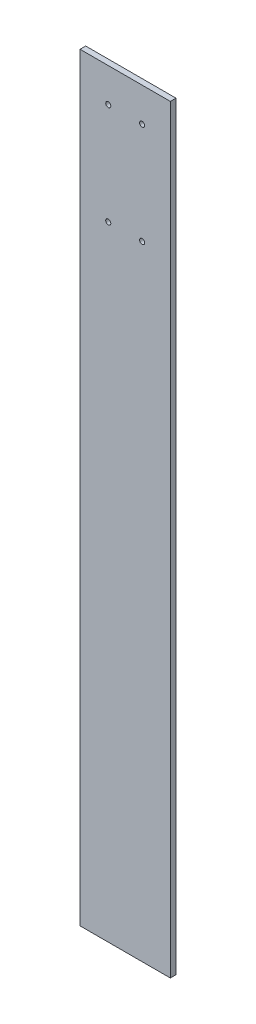
from build123d import *

# Parameters (mm, degrees)
SKETCH1_W           = 50.8
SKETCH1_H           = 3.175
BOSS_EXTRUDE1_DEPTH = 427.1518
SKETCH4_R           = 1.4224
CUT_EXTRUDE2_DEPTH  = 2.54
SKETCH5_W           = 12.58267919
SKETCH5_H           = 101.029760921
BOSS_EXTRUDE2_DEPTH = 2.54
SKETCH6_W           = 7.546607927
SKETCH6_H           = 108.671154153
SKETCH6_W_2         = 9.055929513
BOSS_EXTRUDE3_DEPTH = 2.54
SKETCH7_W           = 50.8
SKETCH7_H           = 16.51
BOSS_EXTRUDE4_DEPTH = 3.175
SKETCH8_W           = 50.8
SKETCH8_H           = 51.188017092
BOSS_EXTRUDE5_DEPTH = 3.175
SKETCH9_W           = 50.8
SKETCH9_H           = 70.169066632
BOSS_EXTRUDE6_DEPTH = 3.175


with BuildPart() as part:
    # Sketch1 → Boss-Extrude1 (new body)
    with BuildSketch(Plane(origin=(0, 0, 0), x_dir=(1, 0, 0), z_dir=(0, 1, 0))):
        with Locations((0, 70.254548969)):
            Rectangle(SKETCH1_W, SKETCH1_H)
    extrude(amount=BOSS_EXTRUDE1_DEPTH)

    # Sketch4 → Cut-Extrude2 (cut)
    with BuildSketch(Plane.XY.offset(-68.667048969)):
        with Locations((-3.175, 376.3518)):
            Circle(SKETCH4_R)
        with Locations((-9.525, 376.3518)):
            Circle(SKETCH4_R)
        with Locations((-9.525, 370.0018)):
            Circle(SKETCH4_R)
        with Locations((-9.525, 363.6518)):
            Circle(SKETCH4_R)
        with Locations((-9.525, 357.3018)):
            Circle(SKETCH4_R)
        with Locations((-9.525, 350.9518)):
            Circle(SKETCH4_R)
        with Locations((-9.525, 344.6018)):
            Circle(SKETCH4_R)
        with Locations((-9.525, 338.2518)):
            Circle(SKETCH4_R)
        with Locations((-9.525, 331.9018)):
            Circle(SKETCH4_R)
        with Locations((-9.525, 325.5518)):
            Circle(SKETCH4_R)
        with Locations((-9.525, 319.2018)):
            Circle(SKETCH4_R)
        with Locations((-9.525, 312.8518)):
            Circle(SKETCH4_R)
        with Locations((-9.525, 306.5018)):
            Circle(SKETCH4_R)
        with Locations((-9.525, 300.1518)):
            Circle(SKETCH4_R)
        with Locations((-9.525, 293.8018)):
            Circle(SKETCH4_R)
        with Locations((-9.525, 287.4518)):
            Circle(SKETCH4_R)
        with Locations((-9.525, 281.1018)):
            Circle(SKETCH4_R)
        with Locations((-3.175, 370.0018)):
            Circle(SKETCH4_R)
        with Locations((-3.175, 363.6518)):
            Circle(SKETCH4_R)
        with Locations((-3.175, 357.3018)):
            Circle(SKETCH4_R)
        with Locations((-3.175, 350.9518)):
            Circle(SKETCH4_R)
        with Locations((-3.175, 344.6018)):
            Circle(SKETCH4_R)
        with Locations((-3.175, 338.2518)):
            Circle(SKETCH4_R)
        with Locations((-3.175, 331.9018)):
            Circle(SKETCH4_R)
        with Locations((-3.175, 325.5518)):
            Circle(SKETCH4_R)
        with Locations((-3.175, 319.2018)):
            Circle(SKETCH4_R)
        with Locations((-3.175, 312.8518)):
            Circle(SKETCH4_R)
        with Locations((-3.175, 306.5018)):
            Circle(SKETCH4_R)
        with Locations((-3.175, 300.1518)):
            Circle(SKETCH4_R)
        with Locations((-3.175, 293.8018)):
            Circle(SKETCH4_R)
        with Locations((-3.175, 287.4518)):
            Circle(SKETCH4_R)
        with Locations((-3.175, 281.1018)):
            Circle(SKETCH4_R)
        with Locations((3.175, 281.1018)):
            Circle(SKETCH4_R)
        with Locations((3.175, 287.4518)):
            Circle(SKETCH4_R)
        with Locations((3.175, 293.8018)):
            Circle(SKETCH4_R)
        with Locations((3.175, 300.1518)):
            Circle(SKETCH4_R)
        with Locations((3.175, 306.5018)):
            Circle(SKETCH4_R)
        with Locations((3.175, 312.8518)):
            Circle(SKETCH4_R)
        with Locations((3.175, 319.2018)):
            Circle(SKETCH4_R)
        with Locations((3.175, 325.5518)):
            Circle(SKETCH4_R)
        with Locations((3.175, 331.9018)):
            Circle(SKETCH4_R)
        with Locations((3.175, 338.2518)):
            Circle(SKETCH4_R)
        with Locations((3.175, 344.6018)):
            Circle(SKETCH4_R)
        with Locations((3.175, 350.9518)):
            Circle(SKETCH4_R)
        with Locations((3.175, 357.3018)):
            Circle(SKETCH4_R)
        with Locations((3.175, 363.6518)):
            Circle(SKETCH4_R)
        with Locations((3.175, 370.0018)):
            Circle(SKETCH4_R)
        with Locations((9.525, 281.1018)):
            Circle(SKETCH4_R)
        with Locations((9.525, 287.4518)):
            Circle(SKETCH4_R)
        with Locations((9.525, 293.8018)):
            Circle(SKETCH4_R)
        with Locations((9.525, 300.1518)):
            Circle(SKETCH4_R)
        with Locations((9.525, 306.5018)):
            Circle(SKETCH4_R)
        with Locations((9.525, 312.8518)):
            Circle(SKETCH4_R)
        with Locations((9.525, 319.2018)):
            Circle(SKETCH4_R)
        with Locations((9.525, 325.5518)):
            Circle(SKETCH4_R)
        with Locations((9.525, 331.9018)):
            Circle(SKETCH4_R)
        with Locations((9.525, 338.2518)):
            Circle(SKETCH4_R)
        with Locations((9.525, 344.6018)):
            Circle(SKETCH4_R)
        with Locations((9.525, 350.9518)):
            Circle(SKETCH4_R)
        with Locations((9.525, 357.3018)):
            Circle(SKETCH4_R)
        with Locations((9.525, 363.6518)):
            Circle(SKETCH4_R)
        with Locations((9.525, 370.0018)):
            Circle(SKETCH4_R)
        with Locations((9.525, 376.3518)):
            Circle(SKETCH4_R)
        with Locations((3.175, 376.3518)):
            Circle(SKETCH4_R)
        with Locations((-9.525, 382.7018)):
            Circle(SKETCH4_R)
        with Locations((9.525, 382.7018)):
            Circle(SKETCH4_R)
        with Locations((-9.525, 389.0518)):
            Circle(SKETCH4_R)
        with Locations((9.525, 389.0518)):
            Circle(SKETCH4_R)
        with Locations((-9.525, 395.4018)):
            Circle(SKETCH4_R)
        with Locations((9.525, 395.4018)):
            Circle(SKETCH4_R)
        with Locations((-9.525, 401.7518)):
            Circle(SKETCH4_R)
        with Locations((9.525, 401.7518)):
            Circle(SKETCH4_R)
        with Locations((-9.525, 408.1018)):
            Circle(SKETCH4_R)
        with Locations((9.525, 408.1018)):
            Circle(SKETCH4_R)
        with Locations((-9.525, 414.4518)):
            Circle(SKETCH4_R)
        with Locations((9.525, 414.4518)):
            Circle(SKETCH4_R)
    extrude(amount=-CUT_EXTRUDE2_DEPTH, mode=Mode.SUBTRACT)

    # Sketch5 → Boss-Extrude2 (add)
    with BuildSketch(Plane.XY.offset(-68.667048969)):
        with Locations((-0.175223229, 328.362881378)):
            Rectangle(SKETCH5_W, SKETCH5_H)
    extrude(amount=-BOSS_EXTRUDE2_DEPTH)

    # Sketch6 → Boss-Extrude3 (add)
    with BuildSketch(Plane.XY.offset(-68.667048969)):
        with Locations((-16.484092579, 326.705642943)):
            Rectangle(SKETCH6_W, SKETCH6_H)
        with Locations((16.9725359, 326.705642943)):
            Rectangle(SKETCH6_W_2, SKETCH6_H)
    extrude(amount=-BOSS_EXTRUDE3_DEPTH)

    # Sketch7 → Boss-Extrude4 (add)
    with BuildSketch(Plane.XY.offset(-68.667048969)):
        with Locations((0, 418.8968)):
            Rectangle(SKETCH7_W, SKETCH7_H)
    extrude(amount=-BOSS_EXTRUDE4_DEPTH)

    # Sketch8 → Boss-Extrude5 (add)
    with BuildSketch(Plane.XY.offset(-68.667048969)):
        with Locations((0, 379.332910144)):
            Rectangle(SKETCH8_W, SKETCH8_H)
    extrude(amount=-BOSS_EXTRUDE5_DEPTH)

    # Sketch9 → Boss-Extrude6 (add)
    with BuildSketch(Plane.XY.offset(-68.667048969)):
        with Locations((0, 312.515447534)):
            Rectangle(SKETCH9_W, SKETCH9_H)
    extrude(amount=-BOSS_EXTRUDE6_DEPTH)


solid = part.part
